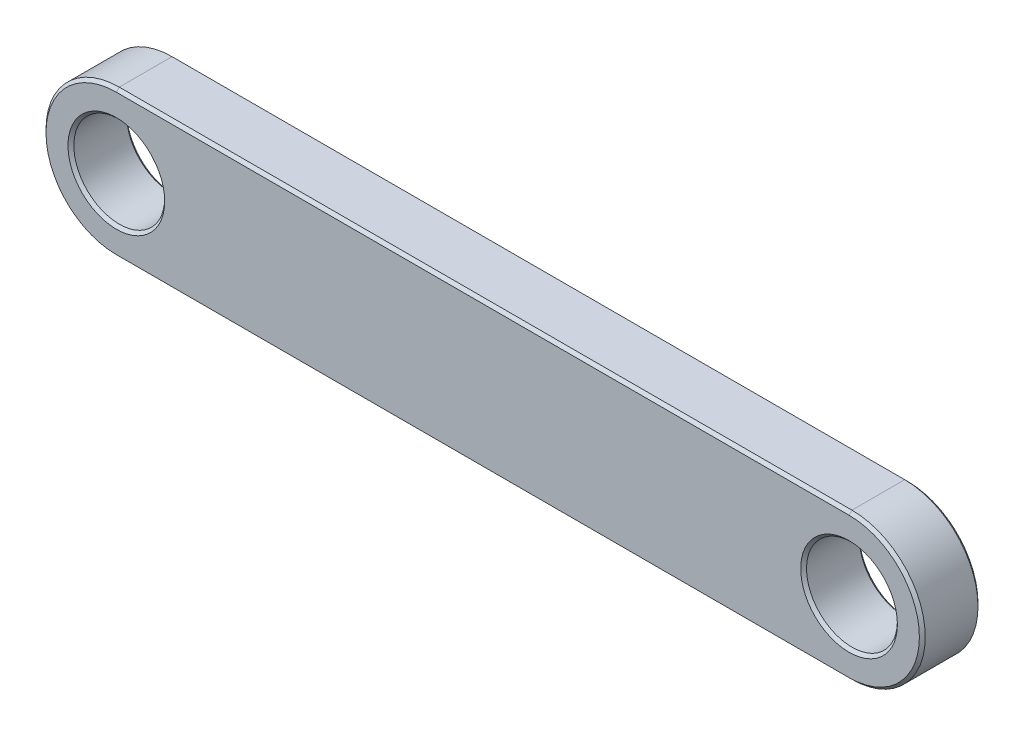
from build123d import *

# Parameters (mm, degrees)
SKETCH1_R           = 1.55
BOSS_EXTRUDE1_DEPTH = 2
CHAMFER1_SIZE       = 0.1


with BuildPart() as part:
    # Sketch1 → Boss-Extrude1 (new body)
    with BuildSketch(Plane.XY):
        with BuildLine():
            Line((12.5, -2.5), (-12.5, -2.5))
            ThreePointArc((-12.5, -2.5), (-15, 0), (-12.5, 2.5))
            Line((-12.5, 2.5), (12.5, 2.5))
            ThreePointArc((12.5, 2.5), (15, 0), (12.5, -2.5))
        make_face()
        with Locations((-12.5, 0)):
            Circle(SKETCH1_R, mode=Mode.SUBTRACT)
        with Locations((12.5, 0)):
            Circle(SKETCH1_R, mode=Mode.SUBTRACT)
    extrude(amount=BOSS_EXTRUDE1_DEPTH)

    # Chamfer1
    chamfer1_edges = [part.edges().sort_by_distance(p)[0] for p in [
        (10.95, 0, 0),
        (-14.05, 0, 0),
        (0, 2.5, 0),
        (-15, 0, 0),
        (0, -2.5, 0),
        (15, 0, 0),
        (10.95, 0, 2),
        (0, -2.5, 2),
        (-15, 0, 2),
        (0, 2.5, 2),
        (15, 0, 2),
        (-14.05, 0, 2),
    ]]
    chamfer(chamfer1_edges, length=CHAMFER1_SIZE)


solid = part.part
